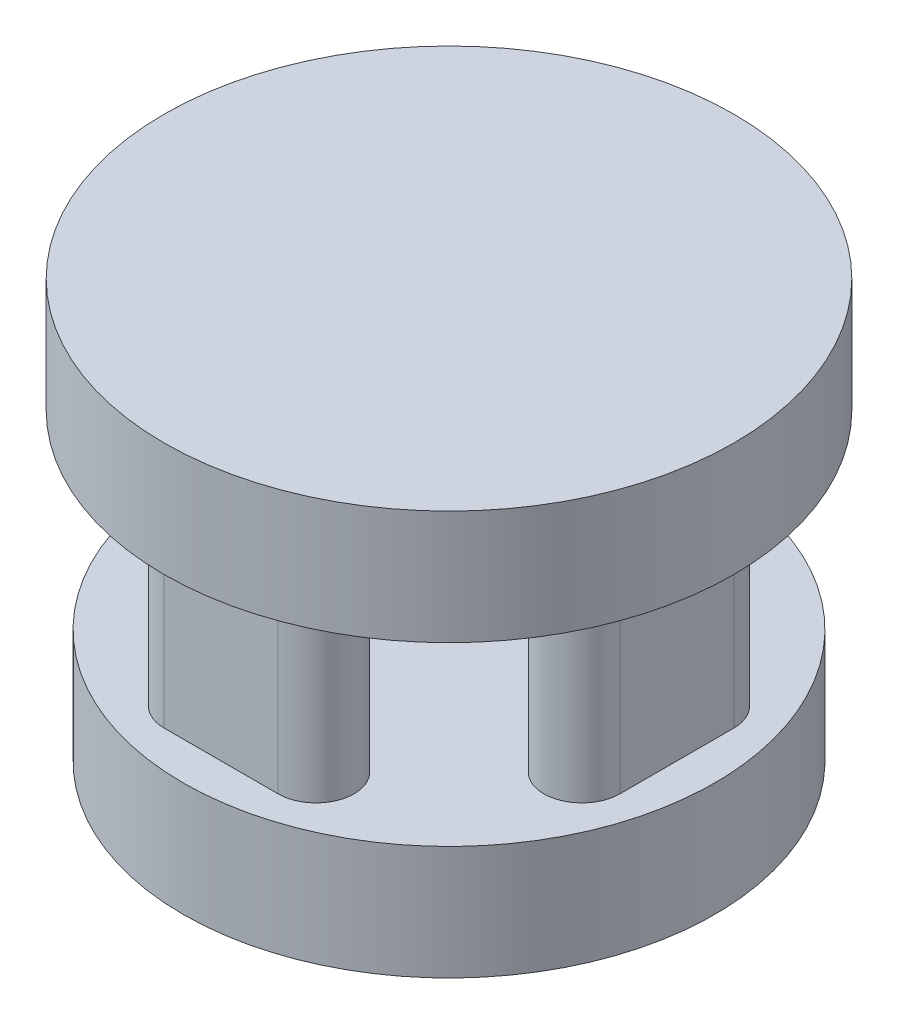
from build123d import *

# Parameters (mm, degrees)
SKETCH1_R            = 9.525
BUTTON_TOP_DEPTH     = 3.81
CONNECTING_LEG_DEPTH = 6.35
MOAR_LEGS_COUNT      = 4
SKETCH3_R            = 8.89
BASE_DEPTH           = 3.81


with BuildPart() as part:
    # Sketch1 → button top (new body)
    with BuildSketch(Plane(origin=(0, 0, 0), x_dir=(1, 0, 0), z_dir=(0, 1, 0))):
        Circle(SKETCH1_R)
    extrude(amount=BUTTON_TOP_DEPTH)

    # Sketch2 → connecting leg (add)
    with BuildSketch(Plane.XZ):
        with BuildLine():
            Line((-1.905, 7.62), (1.905, 7.62))
            ThreePointArc((1.905, 7.62), (3.175, 6.35), (1.905, 5.08))
            Line((1.905, 5.08), (-1.905, 5.08))
            ThreePointArc((-1.905, 5.08), (-3.175, 6.35), (-1.905, 7.62))
        make_face()
    connecting_leg = extrude(amount=CONNECTING_LEG_DEPTH)

    # moar legs: connecting leg ×4 about axis
    moar_legs_axis = Axis((0, 3.81, 0), (0, -1, 0))
    for i in range(1, MOAR_LEGS_COUNT):
        add(connecting_leg.rotate(moar_legs_axis, i * 360 / MOAR_LEGS_COUNT))


with BuildPart() as body_2:
    # Sketch3 → base (new body)
    with BuildSketch(Plane(origin=(0, -6.35, 0), x_dir=(-1, 0, 0), z_dir=(0, -1, 0))):
        Circle(SKETCH3_R)
    extrude(amount=BASE_DEPTH)


solid = Compound([part.part, body_2.part])
